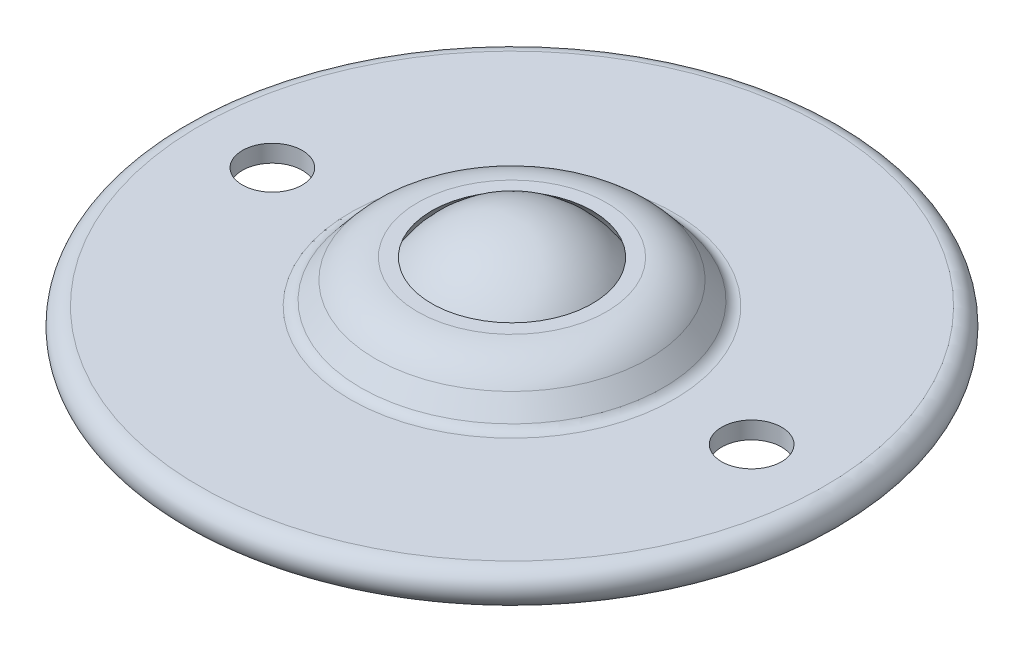
from build123d import *

# Parameters (mm, degrees)
SKETCH3_R          = 2.778125
CUT_EXTRUDE1_DEPTH = 46.781542155
FILLET4_R          = 5.08
FILLET5_R          = 1.27


with BuildPart() as part:
    # Sketch1 → Revolve1 (revolve)
    with BuildSketch(Plane.XY, mode=Mode.PRIVATE) as revolve1_sk:
        with BuildLine():
            Line((14.414592899, 2.40625), (28.959375, 2.40625))
            ThreePointArc((28.959375, 2.40625), (30.559375, 0.80625), (28.959375, -0.79375))
            Line((28.959375, -0.79375), (15.08125, -0.79375))
            ThreePointArc((15.08125, -0.79375), (9.607326509, -9.364696912), (0, -12.7))
            Line((0, -12.7), (0, -9.779))
            ThreePointArc((0, -9.779), (8.874962282, -4.106566145), (7.453854104, 6.33))
            Line((7.453854104, 6.33), (11.144848151, 6.33))
            Line((11.144848151, 6.33), (14.414592899, 2.40625))
        make_face()
    revolve(revolve1_sk.sketch.rotate(Axis((0, -12.7, 0), (0, 1, 0)), 90), axis=Axis((0, -12.7, 0), (0, 1, 0)))

    # Sketch3 → Cut-Extrude1 (cut, through all)
    with BuildSketch(Plane(origin=(0, 2.40625, 0), x_dir=(1, 0, 0), z_dir=(0, 1, 0))):
        with Locations(Location((-22.225, 0, 0), (0, 0, 270))):
            Circle(SKETCH3_R)
        with Locations(Location((22.225, 0, 0), (0, 0, 270))):
            Circle(SKETCH3_R)
    extrude(amount=-CUT_EXTRUDE1_DEPTH, mode=Mode.SUBTRACT)

    # Sketch5 → Cut revolve (revolve, cut)
    with BuildSketch(Plane.XY, mode=Mode.PRIVATE) as cut_revolve_sk:
        with BuildLine():
            Line((15.375264818, 0.80625), (28.959375, 0.80625))
            Line((28.959375, 0.80625), (28.959375, -0.79375))
            Line((28.959375, -0.79375), (15.08125, -0.79375))
            ThreePointArc((15.08125, -0.79375), (15.249256497, 0.002391223), (15.375264818, 0.80625))
        make_face()
    revolve(cut_revolve_sk.sketch.rotate(Axis((0, 18.105086034, 0), (0, 1, 0)), 180), axis=Axis((0, 18.105086034, 0), (0, 1, 0)), mode=Mode.SUBTRACT)

    # Fillet4
    fillet4_edges = [part.edges().sort_by_distance(p)[0] for p in [
        (0, 6.33, 11.144848151),
    ]]
    fillet(fillet4_edges, radius=FILLET4_R)

    # Fillet5
    fillet5_edges = [part.edges().sort_by_distance(p)[0] for p in [
        (15.375264818, 0.80625, 0),
        (0, 2.40625, 14.414592899),
    ]]
    fillet(fillet5_edges, radius=FILLET5_R)


with BuildPart() as body_2:
    # Sketch2 → Revolve2 (revolve)
    with BuildSketch(Plane.XY):
        with BuildLine():
            Line((0, 9.525), (0, -9.525))
            ThreePointArc((0, -9.525), (9.525, 0), (0, 9.525))
        make_face()
    revolve(axis=Axis((0, 9.525, 0), (0, -1, 0)))


solid = Compound([part.part, body_2.part])
